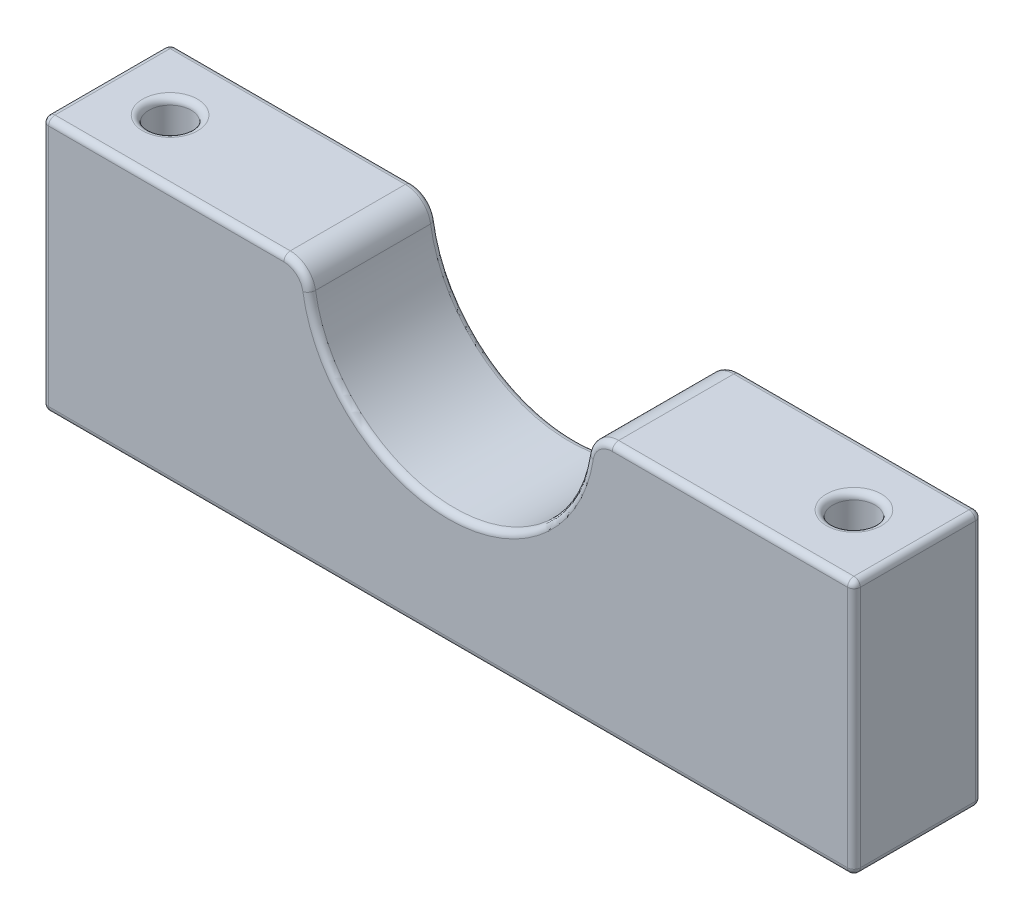
from build123d import *

# Parameters (mm, degrees)
EXTRUDE_1_DEPTH = 10
M4X0_71_D       = 3.3
FILLET_2_R      = 2
FILLET_1_R      = 0.5


with BuildPart() as part:
    # Эскиз1 → Бобышка-Вытянуть1 (new body)
    with BuildSketch(Plane.XY):
        with BuildLine():
            Line((11, 0), (31.75, 0))
            Line((31.75, 0), (31.75, -20))
            Line((31.75, -20), (-31.75, -20))
            Line((-31.75, -20), (-31.75, 0))
            Line((-31.75, 0), (-11, 0))
            ThreePointArc((-11, 0), (0, -11), (11, 0))
        make_face()
    extrude(amount=EXTRUDE_1_DEPTH)

    # Отверстие обработанное метчиком M4x0.71 (through all)
    with Locations(Plane(origin=(0, -20, 0), x_dir=(-1, 0, 0), z_dir=(0, -1, 0))):
        with Locations((26.75, -5), (-26.75, -5)):
            Hole(M4X0_71_D / 2)

    # Скругление2
    fillet_2_edges = [part.edges().sort_by_distance(p)[0] for p in [
        (11, 0, 5),
        (-11, 0, 5),
    ]]
    fillet(fillet_2_edges, radius=FILLET_2_R)

    # Скругление1
    fillet_1_edges = [part.edges().sort_by_distance(p)[0] for p in [
        (31.75, 0, 5),
        (25.1, 0, 5),
        (-31.75, 0, 5),
        (-28.4, 0, 5),
        (-31.75, -20, 5),
        (31.75, -20, 5),
        (25.1, -20, 5),
        (-28.4, -20, 5),
        (-22.297616289, 0, 0),
        (-31.75, -10, 0),
        (0, -20, 0),
        (31.75, -10, 0),
        (22.297616289, 0, 0),
        (0, -11, 0),
        (22.297616289, 0, 10),
        (31.75, -10, 10),
        (0, -20, 10),
        (-31.75, -10, 10),
        (-22.297616289, 0, 10),
        (0, -11, 10),
        (-11.544345307, -0.480890949, 0),
        (11.544345307, -0.480890949, 0),
        (-11.544345307, -0.480890949, 10),
        (11.544345307, -0.480890949, 10),
    ]]
    fillet(fillet_1_edges, radius=FILLET_1_R)


solid = part.part
